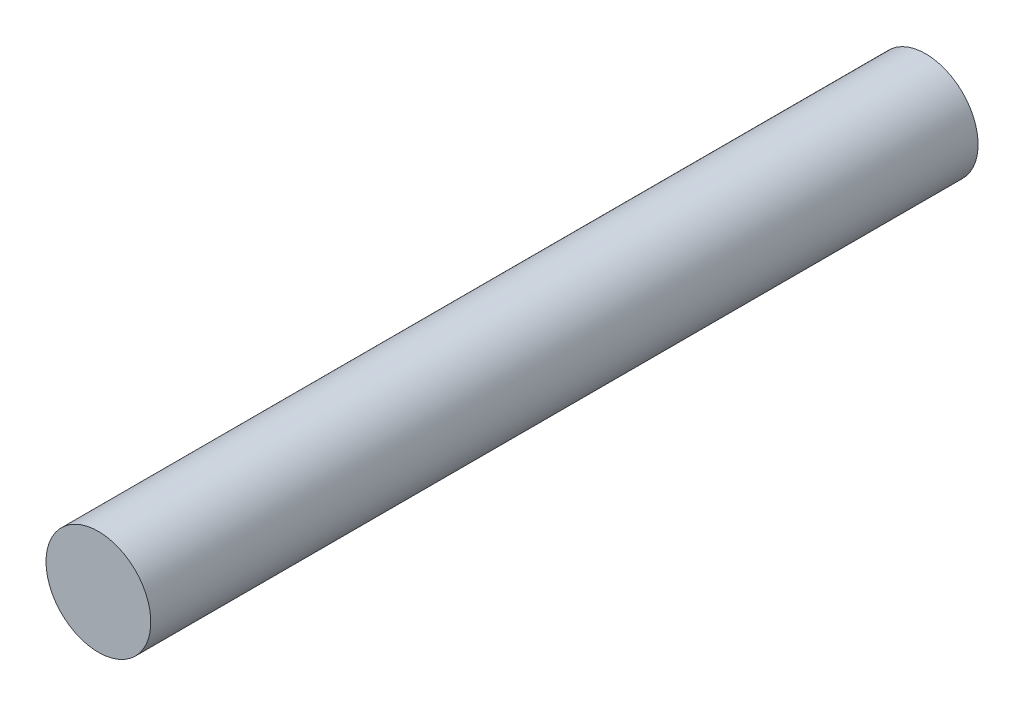
from build123d import *

# Parameters (mm, degrees)
SKETCH1_R           = 4.826
BOSS_EXTRUDE2_DEPTH = 76.2


with BuildPart() as part:
    # Sketch1 → Boss-Extrude2 (new body)
    with BuildSketch(Plane.XY):
        Circle(SKETCH1_R)
    extrude(amount=BOSS_EXTRUDE2_DEPTH)


solid = part.part
